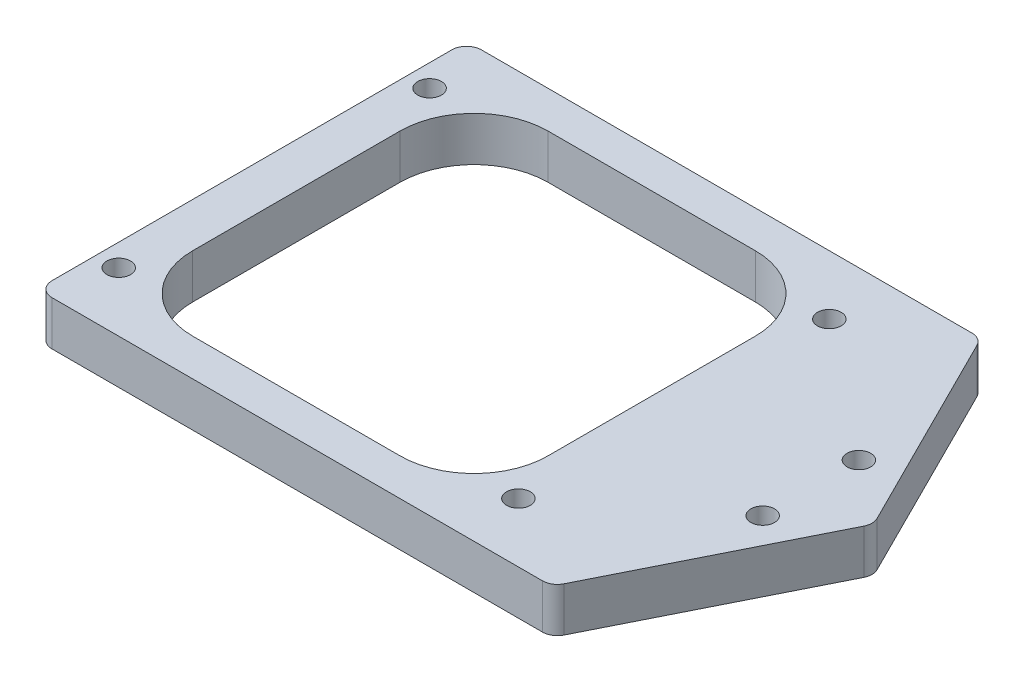
from build123d import *

# Parameters (mm, degrees)
BOSS_EXTRUDE1_DEPTH     = 1.5
CUT_EXTRUDE1_DEPTH      = 52.061237744
CUT_EXTRUDE1_DEPTH_BACK = 52.061237744
SKETCH2_W               = 24
SKETCH2_H               = 24
FILLET1_R               = 5
M2X0_4_TAPPED_HOLE1_D   = 1.6
FILLET2_R               = 1


with BuildPart() as part:
    # Sketch1 → Boss-Extrude1 (new, symmetric)
    with BuildSketch(Plane(origin=(0, 0, 0), x_dir=(1, 0, 0), z_dir=(0, 1, 0))):
        Polygon((0, 0), (34.748434417, 0), (42, 14.5), (34.748434417, 29), (0, 29), align=None)
    extrude(amount=BOSS_EXTRUDE1_DEPTH, both=True)

    # Sketch2 → Cut-Extrude1 (cut, two sides: drawn at the far end of the back side and taken through both)
    with BuildSketch(Plane(origin=(0, 0, 0), x_dir=(1, 0, 0), z_dir=(0, 1, 0)).offset(-CUT_EXTRUDE1_DEPTH_BACK)):
        with Locations((15, 14.5)):
            Rectangle(SKETCH2_W, SKETCH2_H)
    extrude(amount=CUT_EXTRUDE1_DEPTH + CUT_EXTRUDE1_DEPTH_BACK, mode=Mode.SUBTRACT)

    # Fillet1
    fillet1_edges = [part.edges().sort_by_distance(p)[0] for p in [
        (3, 0, -26.5),
        (27, 0, -26.5),
        (27, 0, -2.5),
        (3, 0, -2.5),
    ]]
    fillet(fillet1_edges, radius=FILLET1_R)

    # M2x0.4 Tapped Hole1 (through all)
    with Locations(Plane(origin=(1.5, 1.5, -25), x_dir=(0, 0, 1), z_dir=(0, 1, 0))):
        with Locations((0, 0), (0, 27), (7.25, 36.248434417), (13.75, 36.248434417), (21, 27), (21, 0)):
            Hole(M2X0_4_TAPPED_HOLE1_D / 2)

    # Fillet2
    fillet2_edges = [part.edges().sort_by_distance(p)[0] for p in [
        (0, 0, -29),
        (34.748434417, 0, -29),
        (42, 0, -14.5),
        (34.748434417, 0, 0),
        (0, 0, 0),
    ]]
    fillet(fillet2_edges, radius=FILLET2_R)


solid = part.part
